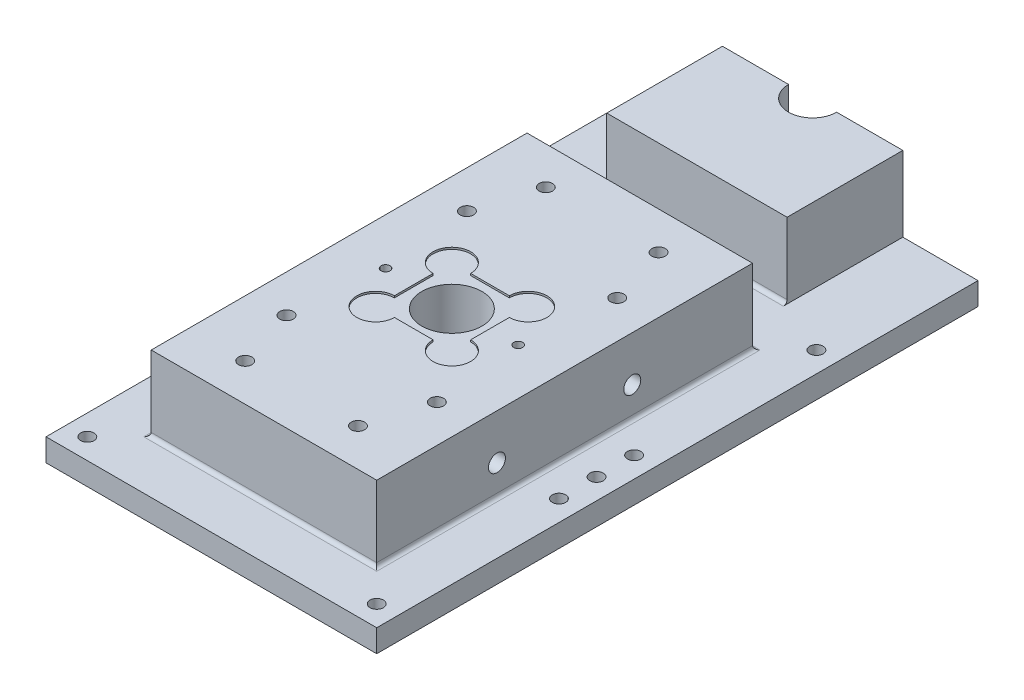
from build123d import *

# Parameters (mm, degrees)
MAIN_BODY_SKETCH_W           = 30
MAIN_BODY_SKETCH_H           = 15
MAIN_BODY_SKETCH_H_2         = 20
MAIN_BODY_SKETCH_R           = 4
MAIN_BODY_DEPTH              = 10
BASE_PLATE_START             = -3
MAIN_BODY_SKETCH_7_W         = 44
MAIN_BODY_SKETCH_7_H         = 80
MAIN_BODY_SKETCH_7_R         = 4
BASE_PLATE_DEPTH             = 3
F_2_56_LID_TAPPED_HOLE2_D    = 1.778
MAIN_BODY_SKETCH_8_W         = 24
MAIN_BODY_SKETCH_8_H         = 15.4
BASE_2_HOLE_CLAMP_POST_DEPTH = 10
F_2_56_TAPPED_HOLE1_D        = 1.778
F_2_56_TAPPED_HOLE1_DEPTH    = 5.19981491
F_2_56_TAPPED_HOLE1_TIP      = 0.53416509
ROD_DIM_SKETCH_R             = 3.2
COLD_ROD_CUT_DEPTH           = 13
F_4_40_TAPPED_HOLE3_D        = 2.2606
F_4_40_TAPPED_HOLE3_DEPTH    = 7.6
F_4_40_TAPPED_HOLE3_TIP      = 0.679152758
CHIP_SOCKET_START            = -0.25
CHIP_POCKET_SKETCH_R         = 2.5
CHIP_POCKET_SKETCH_W         = 10.15
CHIP_POCKET_SKETCH_H         = 10.15
CHIP_POCKET_SKETCH_R_2       = 4
CHIP_SOCKET_DEPTH            = 0.25
M4X0_7_TAPPED_HOLE2_D        = 3.3
M4X0_7_TAPPED_HOLE2_DEPTH    = 10.1
M4X0_7_TAPPED_HOLE2_TIP      = 0.991420021
F_0_80_TAPPED_HOLE1_D        = 1.19126
F_0_80_TAPPED_HOLE1_DEPTH    = 4
F_0_80_TAPPED_HOLE1_TIP      = 0.357890611
FILLET1_R                    = 0.5


# Read off the part's stored shape, not the designer's step: Heat_Cart_mirror_holes
with BuildPart() as part:
    # Main_Body_Sketch → Main_Body (new body)
    # profile 1 of 3: a face of its own
    with BuildSketch(Plane(origin=(0, 0, 0), x_dir=(1, 0, 0), z_dir=(0, 1, 0))):
        with Locations((15, -42.5)):
            Rectangle(MAIN_BODY_SKETCH_W, MAIN_BODY_SKETCH_H)
    # profile 2 of 3: a face of its own
    with BuildSketch(Plane(origin=(0, 0, 0), x_dir=(1, 0, 0), z_dir=(0, 1, 0))):
        with Locations((15, -25)):
            Rectangle(MAIN_BODY_SKETCH_W, MAIN_BODY_SKETCH_H_2)
        with Locations(Location((15, -25, 0), (0, 0, 270))):
            Circle(MAIN_BODY_SKETCH_R, mode=Mode.SUBTRACT)
    # profile 3 of 3: a face of its own
    with BuildSketch(Plane(origin=(0, 0, 0), x_dir=(1, 0, 0), z_dir=(0, 1, 0))):
        with Locations((15, -7.5)):
            Rectangle(MAIN_BODY_SKETCH_W, MAIN_BODY_SKETCH_H)
    extrude(amount=MAIN_BODY_DEPTH)

    # Heat_Cart_mirror_holes outline → Heat_Cart_mirror_holes (revolve, cut)
    with BuildSketch(Plane(origin=(7.5, 0, 45), x_dir=(1, 0, 0), z_dir=(0, 0, 1))):
        Polygon((0, 10), (0, 3.73583491), (0.889, 4.27), (0.889, 10), align=None)
    revolve(axis=Axis((7.5, 0, 45), (0, 1, 0)), mode=Mode.SUBTRACT)

    # Heat_Cart_mirror_holes 2 outline → Heat_Cart_mirror_holes 2 (revolve, cut)
    with BuildSketch(Plane(origin=(7.5, 0, 5), x_dir=(1, 0, 0), z_dir=(0, 0, 1))):
        Polygon((0, 10), (0, 3.73583491), (0.889, 4.27), (0.889, 10), align=None)
    revolve(axis=Axis((7.5, 0, 5), (0, 1, 0)), mode=Mode.SUBTRACT)

    # Heat_Cart_mirror_holes 3 outline → Heat_Cart_mirror_holes 3 (revolve, cut)
    with BuildSketch(Plane(origin=(22.5, 0, 45), x_dir=(1, 0, 0), z_dir=(0, 0, 1))):
        Polygon((0, 10), (0, 3.73583491), (0.889, 4.27), (0.889, 10), align=None)
    revolve(axis=Axis((22.5, 0, 45), (0, 1, 0)), mode=Mode.SUBTRACT)

    # Heat_Cart_mirror_holes 4 outline → Heat_Cart_mirror_holes 4 (revolve, cut)
    with BuildSketch(Plane(origin=(22.5, 0, 5), x_dir=(1, 0, 0), z_dir=(0, 0, 1))):
        Polygon((0, 10), (0, 3.73583491), (0.889, 4.27), (0.889, 10), align=None)
    revolve(axis=Axis((22.5, 0, 5), (0, 1, 0)), mode=Mode.SUBTRACT)

    # Heat_Cart_mirror_holes 5 outline → Heat_Cart_mirror_holes 5 (revolve, cut)
    with BuildSketch(Plane(origin=(25, 0, 37), x_dir=(1, 0, 0), z_dir=(0, 0, 1))):
        Polygon((0, 10), (0, 3.73583491), (0.889, 4.27), (0.889, 10), align=None)
    revolve(axis=Axis((25, 0, 37), (0, 1, 0)), mode=Mode.SUBTRACT)

    # Heat_Cart_mirror_holes 6 outline → Heat_Cart_mirror_holes 6 (revolve, cut)
    with BuildSketch(Plane(origin=(5, 0, 37), x_dir=(1, 0, 0), z_dir=(0, 0, 1))):
        Polygon((0, 10), (0, 3.73583491), (0.889, 4.27), (0.889, 10), align=None)
    revolve(axis=Axis((5, 0, 37), (0, 1, 0)), mode=Mode.SUBTRACT)

    # Heat_Cart_mirror_holes 7 outline → Heat_Cart_mirror_holes 7 (revolve, cut)
    with BuildSketch(Plane(origin=(25, 0, 13), x_dir=(1, 0, 0), z_dir=(0, 0, 1))):
        Polygon((0, 10), (0, 3.73583491), (0.889, 4.27), (0.889, 10), align=None)
    revolve(axis=Axis((25, 0, 13), (0, 1, 0)), mode=Mode.SUBTRACT)

    # Heat_Cart_mirror_holes 8 outline → Heat_Cart_mirror_holes 8 (revolve, cut)
    with BuildSketch(Plane(origin=(5, 0, 13), x_dir=(1, 0, 0), z_dir=(0, 0, 1))):
        Polygon((0, 10), (0, 3.73583491), (0.889, 4.27), (0.889, 10), align=None)
    revolve(axis=Axis((5, 0, 13), (0, 1, 0)), mode=Mode.SUBTRACT)

    # Heat_Cart_mirror_holes 9 outline → Heat_Cart_mirror_holes 9 (revolve, cut)
    with BuildSketch(Plane(origin=(0, 4, 16), x_dir=(0, 1, 0), z_dir=(0, 0, -1))):
        Polygon((0, 30), (0, 21.720847242), (1.1303, 22.4), (1.1303, 30), align=None)
        Polygon((1.1303, 7.6), (0, 8.279152758), (0, 0), (1.1303, 0), align=None)
    revolve(axis=Axis((0, 4, 16), (1, 0, 0)), mode=Mode.SUBTRACT)

    # Heat_Cart_mirror_holes 10 outline → Heat_Cart_mirror_holes 10 (revolve, cut)
    with BuildSketch(Plane(origin=(0, 4, 34), x_dir=(0, 1, 0), z_dir=(0, 0, -1))):
        Polygon((0, 30), (0, 21.720847242), (1.1303, 22.4), (1.1303, 30), align=None)
        Polygon((1.1303, 7.6), (0, 8.279152758), (0, 0), (1.1303, 0), align=None)
    revolve(axis=Axis((0, 4, 34), (1, 0, 0)), mode=Mode.SUBTRACT)

    # Main_Body_Sketch<7> → Base_Plate (add)
    with BuildSketch(Plane(origin=(0, 0, 0), x_dir=(1, 0, 0), z_dir=(0, 1, 0)).offset(BASE_PLATE_START)):
        with Locations((15, -17)):
            Rectangle(MAIN_BODY_SKETCH_7_W, MAIN_BODY_SKETCH_7_H)
        with Locations(Location((15, -25, 0), (0, 0, 270))):
            Circle(MAIN_BODY_SKETCH_7_R, mode=Mode.SUBTRACT)
    extrude(amount=BASE_PLATE_DEPTH)

    # #2-56 Lid Tapped Hole2 (through all)
    with Locations(Plane(origin=(-4.25, 0, -4.25), x_dir=(0, 0, 1), z_dir=(0, 1, 0))):
        with Locations((0, 0), (29.25, 0), (34.25, 0), (58.5, 0), (58.5, 38.5), (34.25, 38.5), (29.25, 38.5), (0, 38.5), (24.25, 0), (24.25, 38.5)):
            Hole(F_2_56_LID_TAPPED_HOLE2_D / 2)

    # Main_Body_Sketch<8> → Base_2_Hole_clamp_Post (add)
    with BuildSketch(Plane(origin=(0, 0, 0), x_dir=(1, 0, 0), z_dir=(0, 1, 0))):
        with Locations((15, 15.3)):
            Rectangle(MAIN_BODY_SKETCH_8_W, MAIN_BODY_SKETCH_8_H)
    extrude(amount=BASE_2_HOLE_CLAMP_POST_DEPTH)

    # #2-56 Tapped Hole1
    with Locations(Plane(origin=(11.19, -3, -18.31), x_dir=(0, 0, -1), z_dir=(0, -1, 0))):
        with Locations((0, 0), (-7.62, 7.62), (-7.62, 0), (0, 7.62)):
            Hole(F_2_56_TAPPED_HOLE1_D / 2, depth=F_2_56_TAPPED_HOLE1_DEPTH)
            with Locations((0, 0, -(F_2_56_TAPPED_HOLE1_DEPTH + F_2_56_TAPPED_HOLE1_TIP / 2))):  # 118° drill point
                Cone(0, F_2_56_TAPPED_HOLE1_D / 2, F_2_56_TAPPED_HOLE1_TIP, mode=Mode.SUBTRACT)

    # Rod_Dim_sketch → Cold_Rod_Cut (cut)
    with BuildSketch(Plane(origin=(0, 10, 0), x_dir=(1, 0, 0), z_dir=(0, 1, 0))):
        with Locations((15, 23)):
            Circle(ROD_DIM_SKETCH_R)
    extrude(amount=-COLD_ROD_CUT_DEPTH, mode=Mode.SUBTRACT)

    # #4-40 Tapped Hole3
    with Locations(Plane(origin=(21.35, 3.5, -23), x_dir=(-1, 0, 0), z_dir=(0, 0, -1))):
        with Locations((0, 0), (12.7, 0)):
            Hole(F_4_40_TAPPED_HOLE3_D / 2, depth=F_4_40_TAPPED_HOLE3_DEPTH)
            with Locations((0, 0, -(F_4_40_TAPPED_HOLE3_DEPTH + F_4_40_TAPPED_HOLE3_TIP / 2))):  # 118° drill point
                Cone(0, F_4_40_TAPPED_HOLE3_D / 2, F_4_40_TAPPED_HOLE3_TIP, mode=Mode.SUBTRACT)

    # Chip_Pocket_sketch → Chip_socket (cut)
    # profile 1 of 21: a face of its own
    with BuildSketch(Plane(origin=(0, 10, 0), x_dir=(1, 0, 0), z_dir=(0, 1, 0)).offset(CHIP_SOCKET_START)):
        with BuildLine():
            ThreePointArc((22.575, -19.925), (20.075, -17.425), (17.575, -19.925))
            Line((17.575, -19.925), (20.075, -19.925))
            Line((20.075, -19.925), (20.075, -22.425))
            ThreePointArc((20.075, -22.425), (21.842766953, -21.692766953), (22.575, -19.925))
        make_face()
    # profile 2 of 21: a face of its own
    with BuildSketch(Plane(origin=(0, 10, 0), x_dir=(1, 0, 0), z_dir=(0, 1, 0)).offset(CHIP_SOCKET_START)):
        with BuildLine():
            Line((20.075, -19.925), (17.575, -19.925))
            ThreePointArc((17.575, -19.925), (18.307233047, -21.692766953), (20.075, -22.425))
            Line((20.075, -22.425), (20.075, -19.925))
        make_face()
    # profile 3 of 21: a face of its own
    with BuildSketch(Plane(origin=(0, 10, 0), x_dir=(1, 0, 0), z_dir=(0, 1, 0)).offset(CHIP_SOCKET_START)):
        with BuildLine():
            ThreePointArc((22.575, -19.925), (20.075, -17.425), (17.575, -19.925))
            Line((17.575, -19.925), (20.075, -19.925))
            Line((20.075, -19.925), (20.075, -22.425))
            ThreePointArc((20.075, -22.425), (21.842766953, -21.692766953), (22.575, -19.925))
        make_face()
    # profile 4 of 21: a face of its own
    with BuildSketch(Plane(origin=(0, 10, 0), x_dir=(1, 0, 0), z_dir=(0, 1, 0)).offset(CHIP_SOCKET_START)):
        with BuildLine():
            Line((20.075, -19.925), (17.575, -19.925))
            ThreePointArc((17.575, -19.925), (18.307233047, -21.692766953), (20.075, -22.425))
            Line((20.075, -22.425), (20.075, -19.925))
        make_face()
    # profile 5 of 21: a face of its own
    with BuildSketch(Plane(origin=(0, 10, 0), x_dir=(1, 0, 0), z_dir=(0, 1, 0)).offset(CHIP_SOCKET_START)):
        with Locations((20.075, -30.075)):
            Circle(CHIP_POCKET_SKETCH_R)
    # profile 6 of 21: a face of its own
    with BuildSketch(Plane(origin=(0, 10, 0), x_dir=(1, 0, 0), z_dir=(0, 1, 0)).offset(CHIP_SOCKET_START)):
        with Locations((20.075, -19.925)):
            Circle(CHIP_POCKET_SKETCH_R)
    # profile 7 of 21: a face of its own
    with BuildSketch(Plane(origin=(0, 10, 0), x_dir=(1, 0, 0), z_dir=(0, 1, 0)).offset(CHIP_SOCKET_START)):
        with Locations((9.925, -19.925)):
            Circle(CHIP_POCKET_SKETCH_R)
    # profile 8 of 21: a face of its own
    with BuildSketch(Plane(origin=(0, 10, 0), x_dir=(1, 0, 0), z_dir=(0, 1, 0)).offset(CHIP_SOCKET_START)):
        with Locations((9.925, -30.075)):
            Circle(CHIP_POCKET_SKETCH_R)
    # profile 9 of 21: a face of its own
    with BuildSketch(Plane(origin=(0, 10, 0), x_dir=(1, 0, 0), z_dir=(0, 1, 0)).offset(CHIP_SOCKET_START)):
        with Locations((15, -25)):
            Rectangle(CHIP_POCKET_SKETCH_W, CHIP_POCKET_SKETCH_H)
        with Locations(Location((15, -25, 0), (0, 0, 270))):
            Circle(CHIP_POCKET_SKETCH_R_2, mode=Mode.SUBTRACT)
    # profile 10 of 21: a face of its own
    with BuildSketch(Plane(origin=(0, 10, 0), x_dir=(1, 0, 0), z_dir=(0, 1, 0)).offset(CHIP_SOCKET_START)):
        with BuildLine():
            ThreePointArc((20.075, -27.575), (18.307233047, -28.307233047), (17.575, -30.075))
            Line((17.575, -30.075), (20.075, -30.075))
            Line((20.075, -30.075), (20.075, -27.575))
        make_face()
    # profile 11 of 21: a face of its own
    with BuildSketch(Plane(origin=(0, 10, 0), x_dir=(1, 0, 0), z_dir=(0, 1, 0)).offset(CHIP_SOCKET_START)):
        with BuildLine():
            Line((20.075, -30.075), (17.575, -30.075))
            ThreePointArc((17.575, -30.075), (20.075, -32.575), (22.575, -30.075))
            ThreePointArc((22.575, -30.075), (21.842766953, -28.307233047), (20.075, -27.575))
            Line((20.075, -27.575), (20.075, -30.075))
        make_face()
    # profile 12 of 21: a face of its own
    with BuildSketch(Plane(origin=(0, 10, 0), x_dir=(1, 0, 0), z_dir=(0, 1, 0)).offset(CHIP_SOCKET_START)):
        with BuildLine():
            ThreePointArc((20.075, -27.575), (18.307233047, -28.307233047), (17.575, -30.075))
            Line((17.575, -30.075), (20.075, -30.075))
            Line((20.075, -30.075), (20.075, -27.575))
        make_face()
    # profile 13 of 21: a face of its own
    with BuildSketch(Plane(origin=(0, 10, 0), x_dir=(1, 0, 0), z_dir=(0, 1, 0)).offset(CHIP_SOCKET_START)):
        with BuildLine():
            Line((20.075, -30.075), (17.575, -30.075))
            ThreePointArc((17.575, -30.075), (20.075, -32.575), (22.575, -30.075))
            ThreePointArc((22.575, -30.075), (21.842766953, -28.307233047), (20.075, -27.575))
            Line((20.075, -27.575), (20.075, -30.075))
        make_face()
    # profile 14 of 21: a face of its own
    with BuildSketch(Plane(origin=(0, 10, 0), x_dir=(1, 0, 0), z_dir=(0, 1, 0)).offset(CHIP_SOCKET_START)):
        with BuildLine():
            ThreePointArc((12.425, -30.075), (11.692766953, -28.307233047), (9.925, -27.575))
            Line((9.925, -27.575), (9.925, -30.075))
            Line((9.925, -30.075), (12.425, -30.075))
        make_face()
    # profile 15 of 21: a face of its own
    with BuildSketch(Plane(origin=(0, 10, 0), x_dir=(1, 0, 0), z_dir=(0, 1, 0)).offset(CHIP_SOCKET_START)):
        with BuildLine():
            Line((9.925, -30.075), (9.925, -27.575))
            ThreePointArc((9.925, -27.575), (8.157233047, -31.842766953), (12.425, -30.075))
            Line((12.425, -30.075), (9.925, -30.075))
        make_face()
    # profile 16 of 21: a face of its own
    with BuildSketch(Plane(origin=(0, 10, 0), x_dir=(1, 0, 0), z_dir=(0, 1, 0)).offset(CHIP_SOCKET_START)):
        with BuildLine():
            ThreePointArc((12.425, -30.075), (11.692766953, -28.307233047), (9.925, -27.575))
            Line((9.925, -27.575), (9.925, -30.075))
            Line((9.925, -30.075), (12.425, -30.075))
        make_face()
    # profile 17 of 21: a face of its own
    with BuildSketch(Plane(origin=(0, 10, 0), x_dir=(1, 0, 0), z_dir=(0, 1, 0)).offset(CHIP_SOCKET_START)):
        with BuildLine():
            Line((9.925, -30.075), (9.925, -27.575))
            ThreePointArc((9.925, -27.575), (8.157233047, -31.842766953), (12.425, -30.075))
            Line((12.425, -30.075), (9.925, -30.075))
        make_face()
    # profile 18 of 21: a face of its own
    with BuildSketch(Plane(origin=(0, 10, 0), x_dir=(1, 0, 0), z_dir=(0, 1, 0)).offset(CHIP_SOCKET_START)):
        with BuildLine():
            Line((12.425, -19.925), (9.925, -19.925))
            Line((9.925, -19.925), (9.925, -22.425))
            ThreePointArc((9.925, -22.425), (11.692766953, -21.692766953), (12.425, -19.925))
        make_face()
    # profile 19 of 21: a face of its own
    with BuildSketch(Plane(origin=(0, 10, 0), x_dir=(1, 0, 0), z_dir=(0, 1, 0)).offset(CHIP_SOCKET_START)):
        with BuildLine():
            Line((9.925, -22.425), (9.925, -19.925))
            Line((9.925, -19.925), (12.425, -19.925))
            ThreePointArc((12.425, -19.925), (8.157233047, -18.157233047), (9.925, -22.425))
        make_face()
    # profile 20 of 21: a face of its own
    with BuildSketch(Plane(origin=(0, 10, 0), x_dir=(1, 0, 0), z_dir=(0, 1, 0)).offset(CHIP_SOCKET_START)):
        with BuildLine():
            Line((12.425, -19.925), (9.925, -19.925))
            Line((9.925, -19.925), (9.925, -22.425))
            ThreePointArc((9.925, -22.425), (11.692766953, -21.692766953), (12.425, -19.925))
        make_face()
    # profile 21 of 21: a face of its own
    with BuildSketch(Plane(origin=(0, 10, 0), x_dir=(1, 0, 0), z_dir=(0, 1, 0)).offset(CHIP_SOCKET_START)):
        with BuildLine():
            Line((9.925, -22.425), (9.925, -19.925))
            Line((9.925, -19.925), (12.425, -19.925))
            ThreePointArc((12.425, -19.925), (8.157233047, -18.157233047), (9.925, -22.425))
        make_face()
    extrude(amount=CHIP_SOCKET_DEPTH, mode=Mode.SUBTRACT)

    # M4x0.7 Tapped Hole2
    with Locations(Plane(origin=(2.3, -3, 37.7), x_dir=(0, 0, -1), z_dir=(0, -1, 0))):
        with Locations((0, 0), (0, 25.4), (25.4, 25.4), (25.4, 0)):
            Hole(M4X0_7_TAPPED_HOLE2_D / 2, depth=M4X0_7_TAPPED_HOLE2_DEPTH)
            with Locations((0, 0, -(M4X0_7_TAPPED_HOLE2_DEPTH + M4X0_7_TAPPED_HOLE2_TIP / 2))):  # 118° drill point
                Cone(0, M4X0_7_TAPPED_HOLE2_D / 2, M4X0_7_TAPPED_HOLE2_TIP, mode=Mode.SUBTRACT)

    # #0-80 Tapped Hole1
    with Locations(Plane(origin=(6.173148192, 10, 25), x_dir=(0, 0, 1), z_dir=(0, 1, 0))):
        with Locations((0, 0), (0, 17.653703616)):
            Hole(F_0_80_TAPPED_HOLE1_D / 2, depth=F_0_80_TAPPED_HOLE1_DEPTH)
            with Locations((0, 0, -(F_0_80_TAPPED_HOLE1_DEPTH + F_0_80_TAPPED_HOLE1_TIP / 2))):  # 118° drill point
                Cone(0, F_0_80_TAPPED_HOLE1_D / 2, F_0_80_TAPPED_HOLE1_TIP, mode=Mode.SUBTRACT)

    # Fillet1
    fillet1_edges = [part.edges().sort_by_distance(p)[0] for p in [
        (15, 0, -7.6),
        (15, 0, 50),
        (0, 0, 25),
        (15, 0, 0),
        (30, 0, 25),
    ]]
    fillet(fillet1_edges, radius=FILLET1_R)


solid = part.part
